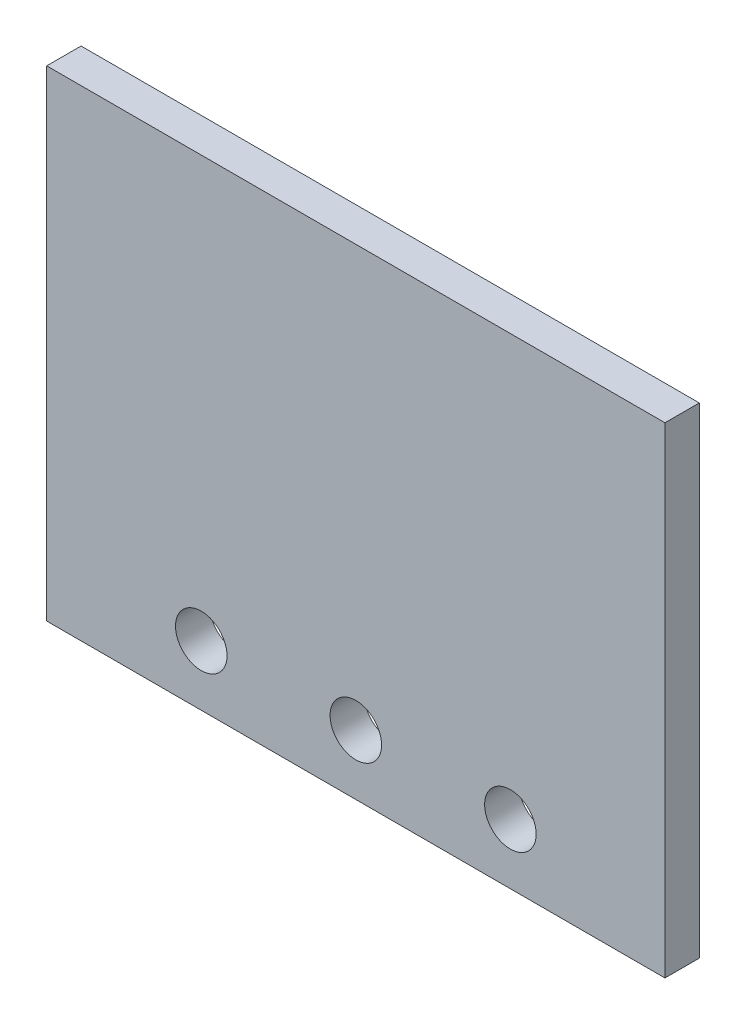
from build123d import *

# Parameters (mm, degrees)
SCHIZZO1_W                   = 360
SCHIZZO1_H                   = 280
SCHIZZO1_R                   = 15
ESTRUSIONE_ESTRUSIONE1_DEPTH = 20


with BuildPart() as part:
    # Schizzo1 → Estrusione-Estrusione1 (new body)
    with BuildSketch(Plane.XY):
        Rectangle(SCHIZZO1_W, SCHIZZO1_H)
        with Locations((-90, -105)):
            Circle(SCHIZZO1_R, mode=Mode.SUBTRACT)
        with Locations((90, -105)):
            Circle(SCHIZZO1_R, mode=Mode.SUBTRACT)
        with Locations((0, -105)):
            Circle(SCHIZZO1_R, mode=Mode.SUBTRACT)
    extrude(amount=ESTRUSIONE_ESTRUSIONE1_DEPTH)


solid = part.part
